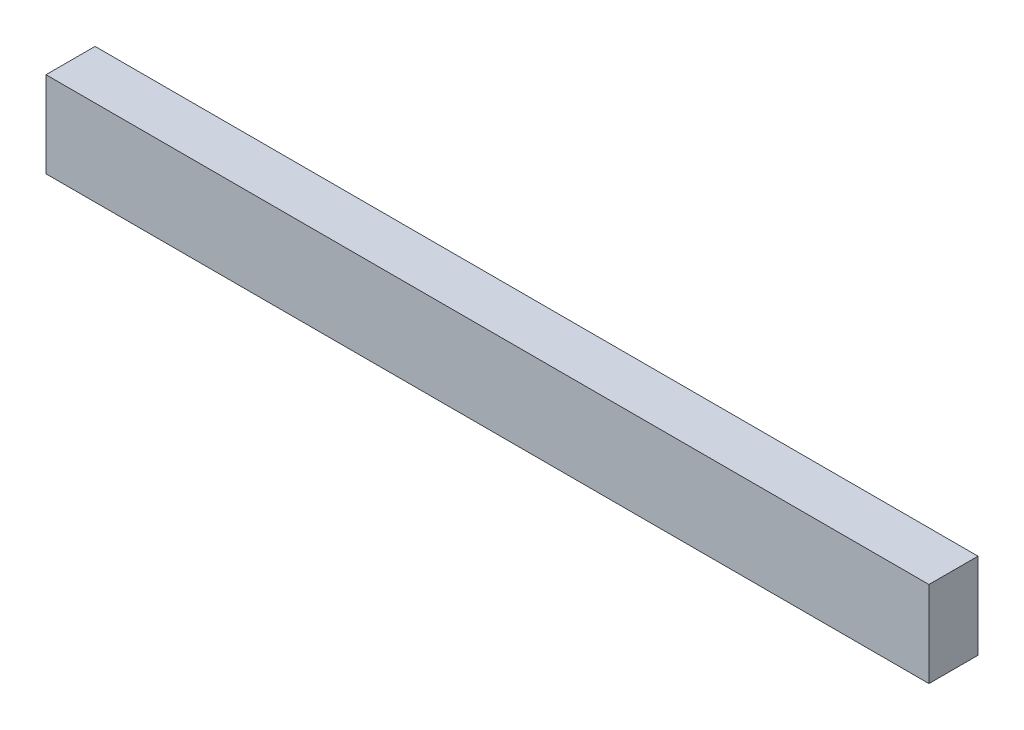
from build123d import *

# Parameters (mm, degrees)
SKETCH1_W           = 228.6
SKETCH1_H           = 22.225
BOSS_EXTRUDE1_DEPTH = 12.7


with BuildPart() as part:
    # Sketch1 → Boss-Extrude1 (new body)
    with BuildSketch(Plane.XY):
        with Locations((114.3, 11.1125)):
            Rectangle(SKETCH1_W, SKETCH1_H)
    extrude(amount=BOSS_EXTRUDE1_DEPTH)


solid = part.part
